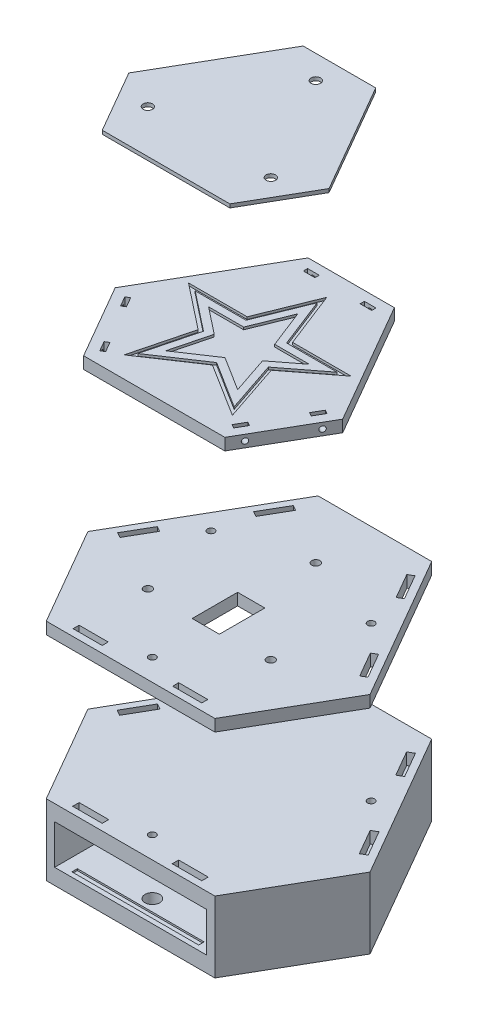
from build123d import *

# Parameters (mm, degrees)
SKETCH1_R                      = 1.49
BOTTOMPLATE_DEPTH              = 30
SKETCH2_R                      = 1.49
SKETCH2_W                      = 12.28
SKETCH2_H                      = 2.54
MIDDLEPLATE_DEPTH              = 5
TOPPLATE_DEPTH                 = 5
SKETCH5_R                      = 1.16
MAINHOLES_DEPTH                = 12
OTHERHOLES_COUNT               = 3
SKETCH8_R                      = 2
PCB_DEPTH                      = 1.5
NAME_START                     = -1
NAME_DEPTH                     = 1
STAR_DEPTH                     = 1
SKETCH18_W                     = 4.9
SKETCH18_H                     = 1.81
TOPFACENUTHOLES_DEPTH          = 5
SKETCH19_W                     = 64.2
SKETCH19_H                     = 16.7
BATTERY_DEPTH                  = 60.2
SKETCH19_3_R                   = 6.6
BATTERYCABLEHOLE_DEPTH         = 192.624263412
SKETCH1_4_W                    = 12.48
SKETCH1_4_H                    = 2.74
BOTTOMPLATESERVOCUT_DEPTH      = 5
SKETCH20_W                     = 53.6
SKETCH20_H                     = 2.3
WIREHOLE_DEPTH                 = 0.7
SKETCH21_R                     = 3.1
RUBBERFEETHOLES_DEPTH          = 26.5
WIREKNOTCH_DEPTH               = 62.5
SKETCH22_R                     = 1.7
SKETCH22_W                     = 11.5
SKETCH22_H                     = 19.2
SERVOHOLEANDCONNECTHOLES_DEPTH = 5
SKETCH23_W                     = 6
SKETCH23_H                     = 12
MIDDLEWIRECUTOUTS_DEPTH        = 2


# Read off the part's stored shape, not the designer's step: Name
with BuildPart() as part:
    # Sketch1 → BottomPlate (new body)
    with BuildSketch(Plane(origin=(0, -120, 0), x_dir=(1, 0, 0), z_dir=(0, 1, 0))):
        Polygon((59.623523599, -6.710844479), (35.623523599, -48.280063861), (-35.623523599, -48.280063861), (-59.623523599, -6.710844479), (-24, 54.990908339), (24, 54.990908339), align=None)
        with Locations(Location((-33.844328085, 19.54003193, 0), (0, 0, 270))):
            Circle(SKETCH1_R, mode=Mode.SUBTRACT)
        with Locations(Location((33.844328085, 19.54003193, 0), (0, 0, 270))):
            Circle(SKETCH1_R, mode=Mode.SUBTRACT)
        with Locations(Location((0, -39.080063861, 0), (0, 0, 270))):
            Circle(SKETCH1_R, mode=Mode.SUBTRACT)
    extrude(amount=-BOTTOMPLATE_DEPTH)

    # Name outline → Name (cut)
    # profile 1 of 7: a face of its own
    with BuildSketch(Plane.XZ.offset(150).offset(NAME_START)):
        with BuildLine():
            add(Edge.make_bspline(
                [(-28.694033388, -0.831367016), (-28.741037328, -0.95880174), (-28.833865851, -1.210473772), (-29.007446267, -1.56974132), (-29.200016788, -1.910725684), (-29.423674711, -2.226509117), (-29.66609623, -2.525565875), (-29.933985334, -2.804222954), (-30.230663625, -3.05718783), (-30.545415289, -3.29233975), (-30.87842937, -3.503953279), (-31.229286597, -3.683266504), (-31.590275425, -3.839060863), (-31.965330849, -3.964306708), (-32.351877753, -4.065574636), (-32.752379848, -4.132160478), (-33.164516992, -4.177388765), (-33.443907584, -4.18244244), (-33.585647312, -4.185006257)],
                knots=[0, 0, 0, 0, 0.0641545, 0.126699324, 0.188330083, 0.249006527, 0.309325989, 0.370140502, 0.431375342, 0.49336455, 0.555704542, 0.617575251, 0.679382668, 0.741335786, 0.804268289, 0.868008556, 0.933038435, 1, 1, 1, 1], degree=3))
            Line((-28.694033388, -0.831367016), (-25.646565034, 7.966892477))
            Line((-25.646565034, 7.966892477), (-30.203527059, 7.966892477))
            Line((-30.203527059, 7.966892477), (-30.730425793, 6.447905135))
            Line((-30.730425793, 6.447905135), (-28.148147312, 6.447905135))
            Line((-28.148147312, 6.447905135), (-30.455109337, -0.211904991))
            add(Edge.make_bspline(
                [(-31.361754907, -1.946873346), (-31.314093127, -1.897103214), (-31.21682163, -1.795528848), (-31.086730433, -1.623508031), (-30.967863373, -1.43232382), (-30.819101104, -1.143097245), (-30.644197668, -0.73570749), (-30.520479843, -0.392990909), (-30.455109337, -0.211904991)],
                knots=[0, 0, 0, 0, 0.104647409, 0.213571755, 0.326987889, 0.446364238, 0.707467786, 1, 1, 1, 1], degree=3))
            add(Edge.make_bspline(
                [(-33.205900477, -2.514120181), (-33.095052618, -2.512608628), (-32.884031147, -2.509731079), (-32.58369432, -2.479921343), (-32.314294134, -2.438316685), (-32.076282738, -2.37031346), (-31.865048901, -2.286820576), (-31.676237051, -2.188477059), (-31.505697336, -2.079239819), (-31.408892135, -1.990219763), (-31.361754907, -1.946873346)],
                knots=[0, 0, 0, 0, 0.16798201, 0.319787964, 0.457220611, 0.58061715, 0.694204393, 0.800956134, 0.903079836, 1, 1, 1, 1], degree=3))
            add(Edge.make_bspline(
                [(-34.79609035, -2.210322713), (-34.67768465, -2.247633408), (-34.432978495, -2.324742506), (-34.049771973, -2.425666778), (-33.637600433, -2.502097205), (-33.35183426, -2.510055881), (-33.205900477, -2.514120181)],
                knots=[0, 0, 0, 0, 0.229013655, 0.473296902, 0.731025631, 1, 1, 1, 1], degree=3))
            Line((-34.79609035, -2.210322713), (-35.095140983, -2.210322713))
            Line((-35.095140983, -2.210322713), (-35.690868831, -3.931050561))
            add(Edge.make_bspline(
                [(-33.585647312, -4.185006257), (-33.655277172, -4.183776696), (-33.804110265, -4.181148524), (-34.04082779, -4.169268616), (-34.304194875, -4.146699941), (-34.682417495, -4.11038689), (-35.149867369, -4.047918178), (-35.515651325, -3.968901202), (-35.690868831, -3.931050561)],
                knots=[0, 0, 0, 0, 0.098352377, 0.210227171, 0.334660271, 0.471635063, 0.746903097, 1, 1, 1, 1], degree=3))
        make_face()
    # profile 2 of 7: a face of its own
    with BuildSketch(Plane.XZ.offset(150).offset(NAME_START)):
        with BuildLine():
            add(Edge.make_bspline(
                [(18.456828492, -3.284602125), (18.427882268, -3.312285196), (18.348742238, -3.378732564), (18.116749488, -3.515116911), (17.777222788, -3.700402739), (17.481384899, -3.825073672), (17.331283068, -3.888329042)],
                knots=[0.126856561, 0.126856561, 0.126856561, 0.126856561, 0.206335754, 0.345716966, 0.668030754, 1, 1, 1, 1], degree=3))
            Line((18.456828492, -3.284602125), (18.197580536, -4.033107523))
            Line((18.197580536, -4.033107523), (20.17226408, -4.033107523))
            Line((20.17226408, -4.033107523), (22.315460283, 2.156765895))
            add(Edge.make_bspline(
                [(22.018783068, 4.667841844), (22.090570732, 4.593511714), (22.231153492, 4.447950011), (22.389261563, 4.190790099), (22.498145628, 3.914293712), (22.554161094, 3.615029402), (22.565330909, 3.291938916), (22.525745996, 2.940102556), (22.444390665, 2.556217252), (22.359920192, 2.294511325), (22.315460283, 2.156765895)],
                knots=[0, 0, 0, 0, 0.114980238, 0.225167364, 0.334139349, 0.444725033, 0.563052852, 0.693443545, 0.838648091, 1, 1, 1, 1], degree=3))
            add(Edge.make_bspline(
                [(19.220523574, 5.384613996), (19.379621248, 5.383417726), (19.687120015, 5.381105616), (20.130568702, 5.345859833), (20.540192717, 5.296690126), (20.912991682, 5.220597962), (21.250390748, 5.125390332), (21.547904205, 5.003584905), (21.806381334, 4.854042073), (21.94933207, 4.728725489), (22.018783068, 4.667841844)],
                knots=[0, 0, 0, 0, 0.161576161, 0.312289108, 0.451652118, 0.580427712, 0.698443407, 0.807252361, 0.90635574, 1, 1, 1, 1], degree=3))
            add(Edge.make_bspline(
                [(15.98555522, 4.931291211), (16.097813433, 4.957762265), (16.331348418, 5.012830995), (16.697511169, 5.091410096), (17.094069375, 5.166738264), (17.514721728, 5.239899732), (17.94661523, 5.303368286), (18.37780742, 5.352658733), (18.801696277, 5.378105917), (19.082046255, 5.382462223), (19.220523574, 5.384613996)],
                knots=[0, 0, 0, 0, 0.105685584, 0.219861695, 0.343130222, 0.475541556, 0.611077371, 0.743091204, 0.873101322, 1, 1, 1, 1], degree=3))
            Line((15.98555522, 4.931291211), (15.354226106, 3.106132984))
            Line((15.354226106, 3.106132984), (15.653276739, 3.113253237))
            add(Edge.make_bspline(
                [(18.677010916, 3.865626654), (18.583575544, 3.862941815), (18.387487056, 3.857307266), (18.079933577, 3.821939811), (17.746308715, 3.765182354), (17.386032792, 3.681557298), (16.995377442, 3.581214609), (16.576347283, 3.447730286), (16.123434459, 3.294675959), (15.81423744, 3.175364157), (15.653276739, 3.113253237)],
                knots=[0, 0, 0, 0, 0.089513307, 0.187857432, 0.296259367, 0.413568624, 0.542066876, 0.682543713, 0.834739718, 1, 1, 1, 1], degree=3))
            add(Edge.make_bspline(
                [(20.203118511, 3.564202604), (20.161148681, 3.592428075), (20.073835122, 3.651148024), (19.921010599, 3.716472007), (19.748068451, 3.767931212), (19.484226591, 3.817351442), (19.125118788, 3.85601376), (18.829812164, 3.862348733), (18.677010916, 3.865626654)],
                knots=[0, 0, 0, 0, 0.095986647, 0.199689533, 0.31437466, 0.438569509, 0.70949761, 1, 1, 1, 1], degree=3))
            add(Edge.make_bspline(
                [(20.383498258, 2.282557034), (20.408883665, 2.358837075), (20.456971442, 2.503334959), (20.499612467, 2.713579124), (20.516860477, 2.902781156), (20.50241486, 3.071091519), (20.464895013, 3.221679454), (20.402136906, 3.354695558), (20.315687633, 3.472105252), (20.240973248, 3.533232112), (20.203118511, 3.564202604)],
                knots=[0, 0, 0, 0, 0.172878686, 0.327485458, 0.46068689, 0.580311561, 0.689336314, 0.792920325, 0.89508116, 1, 1, 1, 1], degree=3))
            Line((20.383498258, 2.282557034), (20.350270409, 2.185246908))
            add(Edge.make_bspline(
                [(15.79805522, 1.492208933), (15.961703924, 1.552809414), (16.295881803, 1.676558271), (16.824632357, 1.811415213), (17.381139755, 1.925428278), (18.163192015, 2.026630152), (19.155919685, 2.114883492), (19.953774487, 2.161887934), (20.350270409, 2.185246908)],
                knots=[0, 0, 0, 0, 0.113141193, 0.231039309, 0.353539834, 0.48150945, 0.742334835, 1, 1, 1, 1], degree=3))
            add(Edge.make_bspline(
                [(13.063878004, -1.310797396), (13.128832077, -1.138208742), (13.255431294, -0.801823542), (13.505716923, -0.337221105), (13.789700147, 0.080429537), (14.119906176, 0.445475477), (14.48919647, 0.763167178), (14.889870321, 1.048536231), (15.328281742, 1.293854305), (15.640052391, 1.425494668), (15.79805522, 1.492208933)],
                knots=[0, 0, 0, 0, 0.136383217, 0.265818722, 0.389612351, 0.509459632, 0.629018921, 0.74959669, 0.87309764, 1, 1, 1, 1], degree=3))
            add(Edge.make_bspline(
                [(15.04805522, -4.336904991), (14.945885721, -4.333915725), (14.747937283, -4.328124168), (14.461266714, -4.290834737), (14.195441673, -4.225200488), (13.951979021, -4.128260032), (13.726934586, -4.011102184), (13.524570798, -3.863259412), (13.343398929, -3.689818738), (13.187092857, -3.489427187), (13.056324475, -3.269925374), (12.95797465, -3.032495865), (12.894147378, -2.779832542), (12.860880565, -2.513583659), (12.861825256, -2.232277938), (12.896539815, -1.936560662), (12.963001682, -1.625936824), (13.029602109, -1.417875904), (13.063878004, -1.310797396)],
                knots=[0, 0, 0, 0, 0.069766954, 0.135170083, 0.197015754, 0.256206497, 0.31372674, 0.369810838, 0.426742004, 0.484454742, 0.542826213, 0.600715683, 0.659286818, 0.720265145, 0.783473816, 0.850889818, 0.923260477, 1, 1, 1, 1], degree=3))
            add(Edge.make_bspline(
                [(17.331283068, -3.888329042), (17.26031532, -3.916644895), (17.111724494, -3.975932051), (16.87482458, -4.055671636), (16.615103289, -4.131519102), (16.335356604, -4.20273697), (16.0362115, -4.262740249), (15.720665543, -4.30446705), (15.389497136, -4.331305974), (15.163615184, -4.335010021), (15.04805522, -4.336904991)],
                knots=[0, 0, 0, 0, 0.097870701, 0.20491968, 0.320054658, 0.444435984, 0.574627718, 0.710653522, 0.851971934, 1, 1, 1, 1], degree=3))
        make_face()
        with BuildLine():
            add(Edge.make_bspline(
                [(16.149321042, -2.666018915), (16.276124342, -2.662409111), (16.529424234, -2.655198233), (16.906979122, -2.595302997), (17.281594008, -2.500882909), (17.770435323, -2.320284124), (18.356694327, -2.049503086), (18.800695468, -1.791274948), (19.018783068, -1.664436637)],
                knots=[0, 0, 0, 0, 0.123537472, 0.246776136, 0.371713666, 0.499528622, 0.754174953, 1, 1, 1, 1], degree=3))
            add(Edge.make_bspline(
                [(15.069415979, -1.225354358), (15.048518378, -1.28754061), (15.008963114, -1.405247596), (14.969520012, -1.578742397), (14.940492759, -1.737786448), (14.934820536, -1.884341763), (14.939377525, -2.017839369), (14.965859002, -2.13727146), (15.008312749, -2.243873413), (15.069462322, -2.336081046), (15.1469198, -2.416608118), (15.243686473, -2.481700281), (15.354190823, -2.539405951), (15.480756149, -2.586924393), (15.62513459, -2.621711656), (15.785497482, -2.646783682), (15.962232225, -2.664321831), (16.085191966, -2.6654372), (16.149321042, -2.666018915)],
                knots=[0, 0, 0, 0, 0.084940203, 0.160775975, 0.230376395, 0.294006244, 0.350469925, 0.402950055, 0.451682209, 0.498309656, 0.545430292, 0.595481495, 0.64866769, 0.706736945, 0.770135172, 0.840747332, 0.916942518, 1, 1, 1, 1], degree=3))
            add(Edge.make_bspline(
                [(16.832865346, 0.317367161), (16.738790564, 0.290144866), (16.552019812, 0.236099263), (16.283780383, 0.118294409), (16.025212294, -0.02023035), (15.779709375, -0.187000477), (15.549778729, -0.38202448), (15.356509889, -0.626049828), (15.190512231, -0.907721529), (15.110671592, -1.117141785), (15.069415979, -1.225354358)],
                knots=[0, 0, 0, 0, 0.119867087, 0.237977337, 0.358114533, 0.47882516, 0.60110174, 0.725839198, 0.858334402, 1, 1, 1, 1], degree=3))
            add(Edge.make_bspline(
                [(19.828118511, 0.675753237), (19.731612862, 0.667674437), (19.522034972, 0.650129993), (19.181599721, 0.625500669), (18.790953314, 0.59083577), (18.36422795, 0.555578207), (17.933248603, 0.513933429), (17.528781312, 0.459075151), (17.165508501, 0.397541521), (16.939425295, 0.343050466), (16.832865346, 0.317367161)],
                knots=[0, 0, 0, 0, 0.096196136, 0.208905731, 0.339038116, 0.4857474, 0.63424118, 0.769054094, 0.891148112, 1, 1, 1, 1], degree=3))
            Line((19.828118511, 0.675753237), (19.018783068, -1.664436637))
        make_face(mode=Mode.SUBTRACT)
    # profile 3 of 7: a face of its own
    with BuildSketch(Plane.XZ.offset(150).offset(NAME_START)):
        with BuildLine():
            add(Edge.make_bspline(
                [(-9.172672629, 0.383822857), (-9.139946507, 0.326953041), (-9.074823179, 0.21378498), (-9.010269589, 0.02765399), (-8.963839796, -0.16540742), (-8.943081602, -0.368834274), (-8.946029945, -0.582130503), (-8.972758785, -0.804686361), (-9.022816297, -1.036768073), (-9.073145609, -1.19094946), (-9.099096679, -1.270449295)],
                knots=[0, 0, 0, 0, 0.114645939, 0.228139628, 0.343386511, 0.461786925, 0.585077764, 0.716175345, 0.853652806, 1, 1, 1, 1], degree=3))
            add(Edge.make_bspline(
                [(-10.615710603, 1.240626654), (-10.529936697, 1.218032468), (-10.363088269, 1.174081986), (-10.127312302, 1.091836885), (-9.913683668, 0.99788153), (-9.721052992, 0.897678728), (-9.551229735, 0.784136775), (-9.399872372, 0.665355248), (-9.274893043, 0.529899104), (-9.206441173, 0.432079189), (-9.172672629, 0.383822857)],
                knots=[0, 0, 0, 0, 0.154832234, 0.301181514, 0.435405277, 0.56208159, 0.679697594, 0.79166203, 0.897223114, 1, 1, 1, 1], degree=3))
            add(Edge.make_bspline(
                [(-12.248621996, 1.606132984), (-12.109550051, 1.57216424), (-11.823498619, 1.502295311), (-11.395285624, 1.41245171), (-10.988579299, 1.331303664), (-10.732633963, 1.269060955), (-10.615710603, 1.240626654)],
                knots=[0, 0, 0, 0, 0.256626059, 0.527843715, 0.784305116, 1, 1, 1, 1], degree=3))
            add(Edge.make_bspline(
                [(-13.050837185, 2.023854503), (-13.006606229, 1.979061354), (-12.912500152, 1.883759152), (-12.725640277, 1.77609982), (-12.503530908, 1.676887295), (-12.33727071, 1.630738945), (-12.248621996, 1.606132984)],
                knots=[0, 0, 0, 0, 0.205125062, 0.436425452, 0.699506198, 1, 1, 1, 1], degree=3))
            add(Edge.make_bspline(
                [(-13.029476426, 2.731132984), (-13.054615469, 2.65168831), (-13.100054283, 2.508092085), (-13.132201446, 2.30900403), (-13.124387548, 2.142127592), (-13.073764542, 2.060722972), (-13.050837185, 2.023854503)],
                knots=[0, 0, 0, 0, 0.339595341, 0.613818482, 0.825096888, 1, 1, 1, 1], degree=3))
            add(Edge.make_bspline(
                [(-10.997830856, 3.865626654), (-11.111930212, 3.862516639), (-11.335720785, 3.85641676), (-11.663280006, 3.80601924), (-11.972943579, 3.720169934), (-12.262344438, 3.603342636), (-12.524454873, 3.451788227), (-12.743298439, 3.252594013), (-12.916315647, 3.010128027), (-12.991179447, 2.825553217), (-13.029476426, 2.731132984)],
                knots=[0, 0, 0, 0, 0.137401543, 0.269494688, 0.398054302, 0.523712681, 0.644663954, 0.760701704, 0.877585674, 1, 1, 1, 1], degree=3))
            add(Edge.make_bspline(
                [(-8.429792882, 2.802335515), (-8.505561648, 2.878682852), (-8.65978207, 3.034080899), (-8.929135041, 3.234089535), (-9.22757476, 3.415834115), (-9.554644761, 3.572336006), (-9.900556915, 3.702295334), (-10.258539322, 3.799095302), (-10.625867595, 3.85397824), (-10.873448647, 3.861731497), (-10.997830856, 3.865626654)],
                knots=[0, 0, 0, 0, 0.112964168, 0.229928273, 0.351624547, 0.479987574, 0.610552858, 0.739695233, 0.869225525, 1, 1, 1, 1], degree=3))
            Line((-8.429792882, 2.802335515), (-7.993084021, 2.802335515))
            Line((-7.993084021, 2.802335515), (-7.366501742, 4.608506401))
            add(Edge.make_bspline(
                [(-10.359381489, 5.384613996), (-10.22002483, 5.382820667), (-9.943082648, 5.379256801), (-9.531955607, 5.33571682), (-9.126301274, 5.273626171), (-8.731248332, 5.180338544), (-8.352368286, 5.067909898), (-7.996239112, 4.937799006), (-7.667429871, 4.787564973), (-7.465224314, 4.66724841), (-7.366501742, 4.608506401)],
                knots=[0, 0, 0, 0, 0.13353165, 0.265366194, 0.395909576, 0.526708253, 0.654121134, 0.774574949, 0.889941004, 1, 1, 1, 1], degree=3))
            add(Edge.make_bspline(
                [(-13.413970097, 4.542050705), (-13.310506341, 4.605481068), (-13.099603868, 4.734778718), (-12.760742217, 4.898680801), (-12.398680549, 5.041945943), (-12.016543638, 5.164059156), (-11.618249312, 5.26464514), (-11.206866345, 5.331840737), (-10.786805033, 5.376796054), (-10.502696567, 5.381992641), (-10.359381489, 5.384613996)],
                knots=[0, 0, 0, 0, 0.113342475, 0.23103944, 0.35115383, 0.476928774, 0.6056604, 0.734604104, 0.866124252, 1, 1, 1, 1], degree=3))
            add(Edge.make_bspline(
                [(-15.072989084, 2.534139313), (-15.036925256, 2.629913462), (-14.964171527, 2.823124408), (-14.819102816, 3.099400031), (-14.652844702, 3.370498125), (-14.456909526, 3.630575987), (-14.237896531, 3.883793064), (-13.985412109, 4.116888208), (-13.71395314, 4.34293925), (-13.514973292, 4.475010605), (-13.413970097, 4.542050705)],
                knots=[0, 0, 0, 0, 0.115620364, 0.233247908, 0.352161112, 0.474899396, 0.601049291, 0.730149523, 0.863022508, 1, 1, 1, 1], degree=3))
            add(Edge.make_bspline(
                [(-13.710647312, 0.013569692), (-13.798065797, 0.040878605), (-13.966131089, 0.093381007), (-14.203207951, 0.188236233), (-14.413936711, 0.295937845), (-14.603986365, 0.408005111), (-14.765313178, 0.534615499), (-14.903800396, 0.668686196), (-15.016472702, 0.81377256), (-15.102523532, 0.970681113), (-15.166876586, 1.136143339), (-15.211523164, 1.309866218), (-15.238935135, 1.492860965), (-15.241105488, 1.684606861), (-15.230916456, 1.885798779), (-15.19508826, 2.093993374), (-15.146442947, 2.312819955), (-15.098071105, 2.458566204), (-15.072989084, 2.534139313)],
                knots=[0, 0, 0, 0, 0.08227933, 0.158185075, 0.229082001, 0.294796198, 0.35608558, 0.412890196, 0.467633439, 0.520455099, 0.573128256, 0.626752269, 0.681342978, 0.738942721, 0.798763281, 0.862108439, 0.928499746, 1, 1, 1, 1], degree=3))
            add(Edge.make_bspline(
                [(-12.089603008, -0.35905689), (-12.211234677, -0.329625411), (-12.472534623, -0.266398095), (-12.88227626, -0.188726132), (-13.302731955, -0.100242446), (-13.578079661, -0.023417902), (-13.710647312, 0.013569692)],
                knots=[0, 0, 0, 0, 0.225609278, 0.484673877, 0.751893435, 1, 1, 1, 1], degree=3))
            add(Edge.make_bspline(
                [(-11.154476426, -0.783898662), (-11.194569382, -0.741923782), (-11.28736029, -0.64477736), (-11.497374682, -0.544691358), (-11.767189287, -0.441231597), (-11.974823631, -0.388311109), (-12.089603008, -0.35905689)],
                knots=[0, 0, 0, 0, 0.165978197, 0.384138991, 0.65955467, 1, 1, 1, 1], degree=3))
            add(Edge.make_bspline(
                [(-11.14023592, -1.460322713), (-11.119086653, -1.390430551), (-11.079947458, -1.261086921), (-11.056479235, -1.074361803), (-11.079539968, -0.910853263), (-11.130368094, -0.824742114), (-11.154476426, -0.783898662)],
                knots=[0, 0, 0, 0, 0.311422813, 0.576324389, 0.799046059, 1, 1, 1, 1], degree=3))
            add(Edge.make_bspline(
                [(-13.466185287, -2.666018915), (-13.318046221, -2.662594489), (-13.034916782, -2.656049584), (-12.630871436, -2.600865687), (-12.267867571, -2.51364192), (-11.946798564, -2.385293253), (-11.670009451, -2.217339687), (-11.440870243, -2.005376984), (-11.257562316, -1.752445693), (-11.179816925, -1.558872754), (-11.14023592, -1.460322713)],
                knots=[0, 0, 0, 0, 0.158077705, 0.302124573, 0.434448998, 0.555681276, 0.669825433, 0.777998732, 0.886976793, 1, 1, 1, 1], degree=3))
            add(Edge.make_bspline(
                [(-16.07694478, -1.450829042), (-15.984633633, -1.54766952), (-15.803503381, -1.737687092), (-15.503885394, -1.98652413), (-15.187114961, -2.196581886), (-14.854574567, -2.367003006), (-14.512442401, -2.500450585), (-14.165562866, -2.595010882), (-13.816369773, -2.655071585), (-13.582717687, -2.662375925), (-13.466185287, -2.666018915)],
                knots=[0, 0, 0, 0, 0.135245825, 0.265375426, 0.393000486, 0.518986653, 0.642633078, 0.763778378, 0.882186061, 1, 1, 1, 1], degree=3))
            Line((-16.07694478, -1.450829042), (-16.45194478, -1.450829042))
            Line((-16.45194478, -1.450829042), (-17.11887516, -3.378044232))
            add(Edge.make_bspline(
                [(-14.107008072, -4.185006257), (-14.267733613, -4.182694388), (-14.579576228, -4.178208859), (-15.03081037, -4.131718359), (-15.451284546, -4.060415515), (-15.839263286, -3.954469594), (-16.196398123, -3.827009139), (-16.529382955, -3.692367059), (-16.835359838, -3.543704751), (-17.026161837, -3.43221745), (-17.11887516, -3.378044232)],
                knots=[0, 0, 0, 0, 0.152571985, 0.296022937, 0.430279709, 0.557117791, 0.677342555, 0.790206422, 0.898058406, 1, 1, 1, 1], degree=3))
            add(Edge.make_bspline(
                [(-9.099096679, -1.270449295), (-9.137158584, -1.372721709), (-9.213277381, -1.577253068), (-9.36957111, -1.867735576), (-9.54882075, -2.148377376), (-9.759050575, -2.41511964), (-9.999146024, -2.668096034), (-10.266819312, -2.910041674), (-10.565558241, -3.137704241), (-10.889109405, -3.352939474), (-11.234842374, -3.549246556), (-11.600260654, -3.717053244), (-11.978662578, -3.863052492), (-12.373520882, -3.982431623), (-12.785871136, -4.070834815), (-13.212734314, -4.138546125), (-13.655400296, -4.175727394), (-13.955046402, -4.181884009), (-14.107008072, -4.185006257)],
                knots=[0, 0, 0, 0, 0.053043622, 0.106080258, 0.160113494, 0.214947186, 0.271047362, 0.329650247, 0.390325613, 0.453641326, 0.518629608, 0.583563137, 0.649123574, 0.715864689, 0.784052365, 0.854180492, 0.926049511, 1, 1, 1, 1], degree=3))
        make_face()
    # profile 4 of 7: a face of its own
    with BuildSketch(Plane.XZ.offset(150).offset(NAME_START)):
        with BuildLine():
            add(Edge.make_bspline(
                [(-20.156849844, 5.384613996), (-19.992881308, 5.380620057), (-19.677151026, 5.37292951), (-19.224179979, 5.311567147), (-18.812197654, 5.208851577), (-18.442762605, 5.060498313), (-18.112916349, 4.87311815), (-17.827137561, 4.639980496), (-17.583710877, 4.364938012), (-17.384747156, 4.050356823), (-17.230403061, 3.701275934), (-17.121650373, 3.323540194), (-17.05733858, 2.919457362), (-17.043051703, 2.489495286), (-17.072112242, 2.033208183), (-17.150818479, 1.550975026), (-17.272023852, 1.040811875), (-17.383760525, 0.697173426), (-17.44165997, 0.519107667)],
                knots=[0, 0, 0, 0, 0.071642452, 0.137951416, 0.199339362, 0.256741703, 0.311424012, 0.364508764, 0.417171802, 0.471271607, 0.526531361, 0.583431631, 0.642608187, 0.704894218, 0.771066912, 0.8421254, 0.918192913, 1, 1, 1, 1], degree=3))
            add(Edge.make_bspline(
                [(-26.099887818, 0.519107667), (-26.033356421, 0.701980078), (-25.902157718, 1.062601137), (-25.668501995, 1.580179815), (-25.40941734, 2.068655306), (-25.124148093, 2.527949163), (-24.812871537, 2.958999332), (-24.474709335, 3.360136231), (-24.114117389, 3.735844819), (-23.724745435, 4.074424171), (-23.321821798, 4.383939663), (-22.902005936, 4.650675379), (-22.471623281, 4.876625542), (-22.030915928, 5.06389347), (-21.577572551, 5.20635288), (-21.113753183, 5.308050147), (-20.638853255, 5.372129623), (-20.318442772, 5.380428577), (-20.156849844, 5.384613996)],
                knots=[0, 0, 0, 0, 0.071117285, 0.140241989, 0.207389099, 0.273115482, 0.337733669, 0.401572466, 0.464771306, 0.527890026, 0.590013005, 0.650345769, 0.709464374, 0.767528753, 0.825152836, 0.88290306, 0.940944387, 1, 1, 1, 1], degree=3))
            add(Edge.make_bspline(
                [(-23.522356173, -4.336904991), (-23.679189446, -4.332677611), (-23.98138619, -4.324532015), (-24.415479045, -4.26614156), (-24.811002247, -4.165694784), (-25.165415577, -4.019034334), (-25.483841566, -3.836772221), (-25.759925169, -3.608168593), (-25.995180063, -3.338187858), (-26.190342189, -3.030131309), (-26.342484958, -2.687127775), (-26.446418292, -2.312013425), (-26.505381818, -1.909426933), (-26.515118673, -1.477916015), (-26.48016932, -1.018042962), (-26.401044362, -0.528989449), (-26.273523939, -0.011394188), (-26.159212906, 0.33785466), (-26.099887818, 0.519107667)],
                knots=[0, 0, 0, 0, 0.069466031, 0.133851752, 0.193611877, 0.249715518, 0.30327427, 0.35555289, 0.407711542, 0.461284053, 0.51651277, 0.57332027, 0.63319539, 0.696305524, 0.764125249, 0.837243955, 0.915532942, 1, 1, 1, 1], degree=3))
            add(Edge.make_bspline(
                [(-17.44165997, 0.519107667), (-17.507369055, 0.340164896), (-17.636924463, -0.01264787), (-17.869671752, -0.52041132), (-18.127349291, -1.002070067), (-18.413295994, -1.457507507), (-18.726246149, -1.886063879), (-19.070750124, -2.285088067), (-19.437690246, -2.662114521), (-19.833626734, -3.006135204), (-20.246364112, -3.320162982), (-20.677050187, -3.591334843), (-21.120426928, -3.820115096), (-21.575945018, -4.008893488), (-22.044327999, -4.156768558), (-22.525749027, -4.261038577), (-23.01987125, -4.324360717), (-23.353657464, -4.332693516), (-23.522356173, -4.336904991)],
                knots=[0, 0, 0, 0, 0.068767794, 0.135586118, 0.201366873, 0.265764566, 0.329489851, 0.392660188, 0.455849231, 0.519177426, 0.581757297, 0.642826361, 0.702583394, 0.761592398, 0.820553729, 0.879575162, 0.939136148, 1, 1, 1, 1], degree=3))
        make_face()
        with BuildLine():
            add(Edge.make_bspline(
                [(-22.997830856, -2.817917649), (-22.904310724, -2.816110171), (-22.718740222, -2.812523622), (-22.444863331, -2.769324553), (-22.176240192, -2.705353423), (-21.913456284, -2.615832269), (-21.657465208, -2.497534854), (-21.407700233, -2.355159419), (-21.164910754, -2.184710543), (-20.927346121, -1.990725351), (-20.699479335, -1.768563466), (-20.479825207, -1.521383593), (-20.275022072, -1.245209731), (-20.078558777, -0.944823061), (-19.897320301, -0.615965663), (-19.723610744, -0.262369631), (-19.562330493, 0.118390753), (-19.465794316, 0.383371092), (-19.416343515, 0.519107667)],
                knots=[0, 0, 0, 0, 0.053506029, 0.106171157, 0.158364574, 0.211516535, 0.264832353, 0.319619555, 0.375921726, 0.434508727, 0.495061313, 0.557966245, 0.623656234, 0.691762239, 0.763354576, 0.838522801, 0.917283063, 1, 1, 1, 1], degree=3))
            add(Edge.make_bspline(
                [(-24.125204274, 0.519107667), (-24.170761152, 0.381844894), (-24.258156251, 0.118523654), (-24.364053911, -0.266838764), (-24.437865972, -0.625298827), (-24.484513496, -0.955897535), (-24.50216526, -1.258395852), (-24.492754735, -1.533295992), (-24.450044374, -1.780744365), (-24.379899733, -2.001195164), (-24.280494351, -2.193682455), (-24.161691152, -2.361025577), (-24.02225966, -2.505065344), (-23.857660524, -2.619096118), (-23.673210121, -2.710531176), (-23.466465346, -2.773882617), (-23.238991406, -2.812369856), (-23.080271644, -2.816021135), (-22.997830856, -2.817917649)],
                knots=[0, 0, 0, 0, 0.101151841, 0.194046993, 0.279349944, 0.356984874, 0.427370661, 0.49106935, 0.548931189, 0.602480423, 0.652226072, 0.699829521, 0.745613052, 0.791673324, 0.839189849, 0.889070744, 0.942382126, 1, 1, 1, 1], degree=3))
            add(Edge.make_bspline(
                [(-20.683748578, 3.865626654), (-20.769333505, 3.863528227), (-20.940561915, 3.859329936), (-21.194102726, 3.819695411), (-21.44338085, 3.757311511), (-21.688677302, 3.672088425), (-21.92948049, 3.559749702), (-22.164771904, 3.420171646), (-22.397355461, 3.259550243), (-22.624474094, 3.07236244), (-22.845394783, 2.859746741), (-23.05492402, 2.6145331), (-23.256448382, 2.340476706), (-23.451664886, 2.037014984), (-23.633107266, 1.699945462), (-23.809045648, 1.334446643), (-23.974922711, 0.938148706), (-24.074246554, 0.661196793), (-24.125204274, 0.519107667)],
                knots=[0, 0, 0, 0, 0.049973206, 0.099980601, 0.149530907, 0.199963724, 0.251455091, 0.30448965, 0.359623771, 0.416439214, 0.47625874, 0.538526453, 0.604625498, 0.674888987, 0.749146864, 0.828120195, 0.91181772, 1, 1, 1, 1], degree=3))
            add(Edge.make_bspline(
                [(-19.416343515, 0.519107667), (-19.370743516, 0.657156376), (-19.283243162, 0.922053551), (-19.178064905, 1.309126801), (-19.102844494, 1.66804531), (-19.059729295, 1.998949566), (-19.042969736, 2.30237576), (-19.059051402, 2.577850877), (-19.102386171, 2.826792781), (-19.179143514, 3.047318117), (-19.281775237, 3.241748054), (-19.408766015, 3.411424614), (-19.562991377, 3.552930054), (-19.741793605, 3.667613212), (-19.943115964, 3.758595238), (-20.168693504, 3.821756276), (-20.418182667, 3.860220577), (-20.592617963, 3.863771525), (-20.683748578, 3.865626654)],
                knots=[0, 0, 0, 0, 0.098920485, 0.189815299, 0.272804213, 0.348262093, 0.416710988, 0.479275185, 0.535662563, 0.588102954, 0.637474483, 0.684743613, 0.731606305, 0.77909261, 0.828727613, 0.881380364, 0.938029283, 1, 1, 1, 1], degree=3))
        make_face(mode=Mode.SUBTRACT)
    # profile 5 of 7: a face of its own
    with BuildSketch(Plane.XZ.offset(150).offset(NAME_START)):
        with BuildLine():
            add(Edge.make_bspline(
                [(-0.495457439, 1.202651971), (-0.432513555, 1.395053813), (-0.311693482, 1.764366968), (-0.192081959, 2.221725123), (-0.129181834, 2.558271337), (-0.102901971, 2.774602125), (-0.102374819, 2.961020226), (-0.122977624, 3.072274174), (-0.132324527, 3.122746908)],
                knots=[0, 0, 0, 0, 0.307830857, 0.59087784, 0.718072884, 0.828215525, 0.922066298, 1, 1, 1, 1], degree=3))
            Line((-0.495457439, 1.202651971), (-2.308748578, -4.033107523))
            Line((-2.308748578, -4.033107523), (-0.334065034, -4.033107523))
            Line((-0.334065034, -4.033107523), (1.711821042, 1.874329186))
            add(Edge.make_bspline(
                [(-0.246248578, 5.384613996), (-0.120299997, 5.382356448), (0.121406831, 5.378024007), (0.466401663, 5.332254329), (0.777418555, 5.26043229), (1.053649997, 5.157969367), (1.297381159, 5.028263367), (1.504104786, 4.863853744), (1.679025273, 4.67202453), (1.813390127, 4.448109968), (1.916151684, 4.201683176), (1.984241824, 3.932119892), (2.022010476, 3.641386775), (2.025382452, 3.328610726), (1.995984697, 2.994911255), (1.931689036, 2.640042273), (1.840232378, 2.262033639), (1.755657404, 2.006681619), (1.711821042, 1.874329186)],
                knots=[0, 0, 0, 0, 0.075190647, 0.144297717, 0.207453131, 0.265472361, 0.319818908, 0.371628472, 0.422489716, 0.474035682, 0.526780751, 0.581452993, 0.6395991, 0.70151178, 0.767912879, 0.839388385, 0.91675281, 1, 1, 1, 1], degree=3))
            add(Edge.make_bspline(
                [(-3.269982755, 4.155183616), (-3.18303226, 4.2464854), (-3.005141987, 4.433277885), (-2.683378926, 4.669183078), (-2.317898256, 4.879021856), (-1.912636351, 5.053633626), (-1.490369996, 5.198624596), (-1.068537428, 5.306951378), (-0.654078475, 5.371120808), (-0.380950977, 5.380157322), (-0.246248578, 5.384613996)],
                knots=[0, 0, 0, 0, 0.11275207, 0.230677196, 0.355761452, 0.489672754, 0.625261274, 0.755375759, 0.879354981, 1, 1, 1, 1], degree=3))
            Line((-3.269982755, 4.155183616), (-1.741501742, 8.574487414))
            Line((-1.741501742, 8.574487414), (-3.716185287, 8.574487414))
            Line((-3.716185287, 8.574487414), (-8.080900477, -4.033107523))
            Line((-8.080900477, -4.033107523), (-6.106216932, -4.033107523))
            Line((-6.106216932, -4.033107523), (-3.75415997, 2.759613996))
            add(Edge.make_bspline(
                [(-1.273938451, 3.71372792), (-1.359616633, 3.710363562), (-1.540319845, 3.70326782), (-1.820571932, 3.646287467), (-2.124593573, 3.560239269), (-2.559545928, 3.395568565), (-3.115587408, 3.141460005), (-3.539602654, 2.887912423), (-3.75415997, 2.759613996)],
                knots=[0, 0, 0, 0, 0.095651673, 0.201738228, 0.318404384, 0.448432507, 0.720899561, 1, 1, 1, 1], degree=3))
            add(Edge.make_bspline(
                [(-0.132324527, 3.122746908), (-0.145027849, 3.170376172), (-0.169681451, 3.26281128), (-0.245523175, 3.384364711), (-0.341928538, 3.490115414), (-0.469518913, 3.573653469), (-0.625912138, 3.637334111), (-0.812623331, 3.684619179), (-1.032833106, 3.708248596), (-1.190031498, 3.711821063), (-1.273938451, 3.71372792)],
                knots=[0, 0, 0, 0, 0.104982753, 0.20374222, 0.30321079, 0.409375529, 0.527024446, 0.663407617, 0.820338865, 1, 1, 1, 1], degree=3))
        make_face()
    # profile 6 of 7: a face of its own
    with BuildSketch(Plane.XZ.offset(150).offset(NAME_START)):
        with BuildLine():
            add(Edge.make_bspline(
                [(8.340776739, -3.107474611), (8.244471512, -3.195111705), (8.047265839, -3.374567512), (7.710552213, -3.60719819), (7.337521741, -3.816634259), (6.933874465, -4.000061618), (6.507118851, -4.148095837), (6.069936573, -4.258501047), (5.624451503, -4.32468883), (5.325172634, -4.33281672), (5.174637498, -4.336904991)],
                knots=[0, 0, 0, 0, 0.112308464, 0.229975747, 0.352303874, 0.481291641, 0.612185602, 0.741721887, 0.870087952, 1, 1, 1, 1], degree=3))
            Line((8.340776739, -3.107474611), (8.020365346, -4.033107523))
            Line((8.020365346, -4.033107523), (9.99504889, -4.033107523))
            Line((9.99504889, -4.033107523), (13.15169446, 5.080816528))
            Line((13.15169446, 5.080816528), (11.177010916, 5.080816528))
            Line((11.177010916, 5.080816528), (8.83919446, -1.666810054))
            add(Edge.make_bspline(
                [(6.197580536, -2.666018915), (6.289560016, -2.661724206), (6.484415227, -2.652626018), (6.788294142, -2.594894392), (7.117511909, -2.499767682), (7.466631355, -2.373148003), (7.822885115, -2.220397316), (8.174956413, -2.053275979), (8.512419561, -1.866567889), (8.730488898, -1.733261877), (8.83919446, -1.666810054)],
                knots=[0, 0, 0, 0, 0.096687739, 0.204829486, 0.324076473, 0.456643848, 0.594874684, 0.731371383, 0.866091102, 1, 1, 1, 1], degree=3))
            add(Edge.make_bspline(
                [(5.179384334, -2.070291067), (5.194307389, -2.125424349), (5.222093595, -2.228080584), (5.286253007, -2.365231971), (5.367888205, -2.471329039), (5.466895994, -2.556082286), (5.59919099, -2.606637368), (5.764158739, -2.639760958), (5.96750171, -2.663698178), (6.116807227, -2.665204179), (6.197580536, -2.666018915)],
                knots=[0, 0, 0, 0, 0.129938733, 0.241941359, 0.342119552, 0.433005627, 0.534727093, 0.660179659, 0.816159417, 1, 1, 1, 1], degree=3))
            add(Edge.make_bspline(
                [(5.566251422, -0.154942966), (5.527651932, -0.267079006), (5.454272913, -0.480253649), (5.35902827, -0.788281466), (5.280257521, -1.06657676), (5.219972444, -1.316595207), (5.177938562, -1.539899879), (5.155758677, -1.738091279), (5.152278875, -1.913867106), (5.170771454, -2.02058666), (5.179384334, -2.070291067)],
                knots=[0, 0, 0, 0, 0.180360379, 0.342871562, 0.490303873, 0.620177776, 0.733935031, 0.83558723, 0.923425099, 1, 1, 1, 1], degree=3))
            Line((5.566251422, -0.154942966), (7.379542561, 5.080816528))
            Line((7.379542561, 5.080816528), (5.404859017, 5.080816528))
            Line((5.404859017, 5.080816528), (3.358972941, -0.826620181))
            add(Edge.make_bspline(
                [(5.174637498, -4.336904991), (5.059758051, -4.334500943), (4.839421084, -4.329890018), (4.524737923, -4.286017957), (4.237799599, -4.219116544), (3.981114456, -4.119032193), (3.751765635, -3.993479953), (3.554023323, -3.836591492), (3.385934002, -3.651308288), (3.247087854, -3.438673727), (3.142253485, -3.197921507), (3.071697964, -2.932250765), (3.034589081, -2.641138604), (3.030434722, -2.325874235), (3.06396187, -1.985251882), (3.128828459, -1.620458346), (3.226832116, -1.229598328), (3.31374314, -0.96455349), (3.358972941, -0.826620181)],
                knots=[0, 0, 0, 0, 0.070069156, 0.134391535, 0.193528901, 0.249477995, 0.302001436, 0.352522748, 0.402766443, 0.45405709, 0.506806401, 0.562322578, 0.621252626, 0.685475263, 0.754322755, 0.829811536, 0.91143137, 1, 1, 1, 1], degree=3))
        make_face()
    # profile 7 of 7: a face of its own
    with BuildSketch(Plane.XZ.offset(150).offset(NAME_START)):
        Polygon((41.03697927, 7.966892477), (32.986346359, 7.966892477), (28.830491928, -4.033107523), (30.805175473, -4.033107523), (32.751378004, 1.587145642), (38.067833701, 1.587145642), (38.646947625, 3.258031718), (33.330491928, 3.258031718), (34.381915979, 6.296006401), (40.457865346, 6.296006401), align=None)
    extrude(amount=NAME_DEPTH, mode=Mode.SUBTRACT)

    # Sketch19 → Battery (cut)
    with BuildSketch(Plane.XY.offset(48.280063861)):
        with Locations((0, -135)):
            Rectangle(SKETCH19_W, SKETCH19_H)
    extrude(amount=-BATTERY_DEPTH, mode=Mode.SUBTRACT)

    # Sketch19<3> → BatteryCableHole (cut, through all)
    with BuildSketch(Plane.XY.offset(48.280063861)):
        with Locations((0, -135)):
            Circle(SKETCH19_3_R)
    extrude(amount=-BATTERYCABLEHOLE_DEPTH, mode=Mode.SUBTRACT)

    # Sketch1<4> → BottomPlateServoCut (cut)
    with BuildSketch(Plane(origin=(0, -120, 0), x_dir=(1, 0, 0), z_dir=(0, 1, 0))):
        with Locations((-21.04, -44.110063861)):
            Rectangle(SKETCH1_4_W, SKETCH1_4_H)
        Polygon((-53.026890669, -0.885141085), (-50.653981063, -2.255141085), (-44.413981063, 8.552855954), (-46.786890669, 9.922855954), align=None)
        Polygon((-23.373981063, 44.995204946), (-29.613981063, 34.187207906), (-31.986890669, 35.557207906), (-25.746890669, 46.365204946), align=None)
        with Locations((21.04, -44.110063861)):
            Rectangle(SKETCH1_4_W, SKETCH1_4_H)
        Polygon((50.653981063, -2.255141085), (44.413981063, 8.552855954), (46.786890669, 9.922855954), (53.026890669, -0.885141085), align=None)
        Polygon((25.746890669, 46.365204946), (23.373981063, 44.995204946), (29.613981063, 34.187207906), (31.986890669, 35.557207906), align=None)
    extrude(amount=-BOTTOMPLATESERVOCUT_DEPTH, mode=Mode.SUBTRACT)

    # Sketch20 → WireHole (cut)
    with BuildSketch(Plane(origin=(0, -143.35, 0), x_dir=(1, 0, 0), z_dir=(0, 1, 0))):
        with Locations((0, -45.130063861)):
            Rectangle(SKETCH20_W, SKETCH20_H)
    extrude(amount=-WIREHOLE_DEPTH, mode=Mode.SUBTRACT)

    # Sketch21 → RubberFeetHoles (cut)
    with BuildSketch(Plane.XZ.offset(150)):
        with Locations(Location((0, 39.080063861, 0), (0, 0, 270))):
            Circle(SKETCH21_R)
        with Locations(Location((33.844328085, -19.54003193, 0), (0, 0, 270))):
            Circle(SKETCH21_R)
        with Locations(Location((-33.844328085, -19.54003193, 0), (0, 0, 270))):
            Circle(SKETCH21_R)
    extrude(amount=-RUBBERFEETHOLES_DEPTH, mode=Mode.SUBTRACT)

    # Sketch19<4> → WireKnotch (cut)
    with BuildSketch(Plane.XY.offset(48.280063861)):
        with BuildLine():
            Line((0, -141.6), (0, -143.35))
            Line((0, -143.35), (32.1, -143.35))
            Line((32.1, -143.35), (32.1, -133.952702019))
            Line((32.1, -133.952702019), (6.516376826, -133.952702019))
            ThreePointArc((6.516376826, -133.952702019), (6.579060991, -134.474684405), (6.6, -135))
            ThreePointArc((6.6, -135), (4.666904756, -139.666904756), (0, -141.6))
        make_face()
    extrude(amount=-WIREKNOTCH_DEPTH, mode=Mode.SUBTRACT)


with BuildPart() as body_2:
    # Sketch2 → MiddlePlate (new body)
    with BuildSketch(Plane(origin=(0, -60, 0), x_dir=(1, 0, 0), z_dir=(0, 1, 0))):
        Polygon((59.623523599, -6.710844479), (35.623523599, -48.280063861), (-35.623523599, -48.280063861), (-59.623523599, -6.710844479), (-24, 54.990908339), (24, 54.990908339), align=None)
        with Locations(Location((0, -39.080063861, 0), (0, 0, 270))):
            Circle(SKETCH2_R, mode=Mode.SUBTRACT)
        with Locations(Location((33.844328085, 19.54003193, 0), (0, 0, 270))):
            Circle(SKETCH2_R, mode=Mode.SUBTRACT)
        with Locations(Location((-33.844328085, 19.54003193, 0), (0, 0, 270))):
            Circle(SKETCH2_R, mode=Mode.SUBTRACT)
        with Locations((21.04, -44.110063861)):
            Rectangle(SKETCH2_W, SKETCH2_H, mode=Mode.SUBTRACT)
        with Locations((-21.04, -44.110063861)):
            Rectangle(SKETCH2_W, SKETCH2_H, mode=Mode.SUBTRACT)
        Polygon((-50.690583603, -2.118538545), (-44.550583603, 8.516253414), (-46.750288129, 9.786253414), (-52.890288129, -0.848538545), align=None, mode=Mode.SUBTRACT)
        Polygon((-23.510583603, 44.958602405), (-29.650583603, 34.323810447), (-31.850288129, 35.593810447), (-25.710288129, 46.228602405), align=None, mode=Mode.SUBTRACT)
        Polygon((23.510583603, 44.958602405), (29.650583603, 34.323810447), (31.850288129, 35.593810447), (25.710288129, 46.228602405), align=None, mode=Mode.SUBTRACT)
        Polygon((50.690583603, -2.118538545), (44.550583603, 8.516253414), (46.750288129, 9.786253414), (52.890288129, -0.848538545), align=None, mode=Mode.SUBTRACT)
    extrude(amount=MIDDLEPLATE_DEPTH)

    # Sketch22 → ServoHoleAndConnectHoles (cut)
    with BuildSketch(Plane(origin=(0, -55, 0), x_dir=(1, 0, 0), z_dir=(0, 1, 0))):
        with Locations(Location((-25.980762114, -15, 0), (0, 0, 270))):
            Circle(SKETCH22_R)
        with Locations(Location((0, 30, 0), (0, 0, 270))):
            Circle(SKETCH22_R)
        with Locations(Location((25.980762114, -15, 0), (0, 0, 270))):
            Circle(SKETCH22_R)
        with Locations((0, -6.9)):
            Rectangle(SKETCH22_W, SKETCH22_H)
    extrude(amount=-SERVOHOLEANDCONNECTHOLES_DEPTH, mode=Mode.SUBTRACT)

    # Sketch23 → MiddleWireCutouts (cut)
    with BuildSketch(Plane.XZ.offset(60)):
        with Locations((21.04, 26.340063861)):
            Rectangle(SKETCH23_W, SKETCH23_H)
        with Locations((-21.04, 26.340063861)):
            Rectangle(SKETCH23_W, SKETCH23_H)
        Polygon((26.635012018, 5.453066354), (29.635012018, 10.649218777), (40.027316863, 4.649218777), (37.027316863, -0.546933646), align=None)
        Polygon((18.987316863, -31.793130215), (8.595012018, -25.793130215), (5.595012018, -30.989282637), (15.987316863, -36.989282637), align=None)
        Polygon((-8.595012018, -25.793130215), (-5.595012018, -30.989282637), (-15.987316863, -36.989282637), (-18.987316863, -31.793130215), align=None)
        Polygon((-37.027316863, -0.546933646), (-26.635012018, 5.453066354), (-29.635012018, 10.649218777), (-40.027316863, 4.649218777), align=None)
    extrude(amount=-MIDDLEWIRECUTOUTS_DEPTH, mode=Mode.SUBTRACT)


with BuildPart() as body_3:
    # Sketch3 → TopPlate (new body)
    with BuildSketch(Plane(origin=(0, 40, 0), x_dir=(1, 0, 0), z_dir=(0, 1, 0))):
        Polygon((-48.076518215, -6.710844479), (-18.226497308, 44.990908339), (18.226497308, 44.990908339), (48.076518215, -6.710844479), (29.850020907, -38.280063861), (-29.850020907, -38.280063861), align=None)
    extrude(amount=-TOPPLATE_DEPTH)

    # Sketch5 → MainHoles (cut)
    with BuildSketch(Plane(origin=(38.963269561, 0, 22.49545417), x_dir=(0.5000000000000003, 0, -0.8660254037844386), z_dir=(0.8660254037844386, 0, 0.5000000000000003))):
        with Locations((-12, 37.5)):
            Circle(SKETCH5_R)
        with Locations(Location((12, 37.5, 0), (0, 0, 180))):
            Circle(SKETCH5_R)
    mainholes = extrude(amount=-MAINHOLES_DEPTH, mode=Mode.SUBTRACT)

    # OtherHoles: MainHoles ×3 about axis
    otherholes_axis = Axis((0, 0, 0), (0, 1, 0))
    for i in range(1, OTHERHOLES_COUNT):
        add(mainholes.rotate(otherholes_axis, i * 360 / OTHERHOLES_COUNT), mode=Mode.SUBTRACT)

    # Sketch15 → Star (cut)
    # profile 1 of 2: a face of its own
    with BuildSketch(Plane(origin=(0, 40, 0), x_dir=(1, 0, 0), z_dir=(0, 1, 0))):
        Polygon((-15.219122288, -4.519173398), (-34.338172423, 10.55108087), (-9.5600656, 10.55108087), (0.136143229, 34.519692369), (9.404825499, 10.793711113), (34.143664323, 10.793711113), (15.081900732, -3.910914413), (23.374937648, -28.621173266), (0.764801917, -14.436467747), (-21.619637129, -29.389007565), align=None)
        Polygon((-13.522808484, -3.946302614), (-30.012087433, 9.05108087), (-8.54878255, 9.05108087), (0.111808671, 30.459690152), (8.380412297, 9.293711113), (29.743399344, 9.293711113), (13.320023764, -3.375609153), (20.617950214, -25.120797734), (0.739229386, -12.649673969), (-19.188578592, -25.961213368), align=None, mode=Mode.SUBTRACT)
    # profile 2 of 2: a face of its own
    with BuildSketch(Plane(origin=(0, 40, 0), x_dir=(1, 0, 0), z_dir=(0, 1, 0))):
        Polygon((-21.359917453, 6.05108087), (-6.52621645, 6.05108087), (0.063139555, 22.339685717), (6.331585893, 6.293711113), (20.942869384, 6.293711113), (9.79626983, -2.304998631), (15.103975345, -18.120046669), (0.688084326, -9.076086414), (-14.326461517, -19.105624974), (-10.130180876, -2.800561047), align=None)
    extrude(amount=-STAR_DEPTH, mode=Mode.SUBTRACT)

    # Sketch18 → TopFaceNutHoles (cut)
    with BuildSketch(Plane(origin=(0, 40, 0), x_dir=(1, 0, 0), z_dir=(0, 1, 0))):
        with Locations((-12, 40.085908339)):
            Rectangle(SKETCH18_W, SKETCH18_H)
        with Locations((12, 40.085908339)):
            Rectangle(SKETCH18_W, SKETCH18_H)
        Polygon((41.156661965, -7.076387085), (42.724167946, -7.981387085), (40.274167946, -12.224911564), (38.706661965, -11.319911564), align=None)
        Polygon((26.706661965, -32.104521254), (29.156661965, -27.860996776), (30.724167946, -28.765996776), (28.274167946, -33.009521254), align=None)
        Polygon((-26.706661965, -32.104521254), (-28.274167946, -33.009521254), (-30.724167946, -28.765996776), (-29.156661965, -27.860996776), align=None)
        Polygon((-41.156661965, -7.076387085), (-38.706661965, -11.319911564), (-40.274167946, -12.224911564), (-42.724167946, -7.981387085), align=None)
    extrude(amount=-TOPFACENUTHOLES_DEPTH, mode=Mode.SUBTRACT)


with BuildPart() as body_4:
    # Sketch8 → PCB (new body)
    with BuildSketch(Plane(origin=(0, 120, 0), x_dir=(1, 0, 0), z_dir=(0, 1, 0))):
        Polygon((-42.303015523, -6.710844479), (-15.339745962, 39.990908339), (15.339745962, 39.990908339), (42.303015523, -6.710844479), (26.963269561, -33.280063861), (-26.963269561, -33.280063861), align=None)
        with Locations(Location((-25.980762114, -15, 0), (0, 0, 270))):
            Circle(SKETCH8_R, mode=Mode.SUBTRACT)
        with Locations(Location((25.980762114, -15, 0), (0, 0, 270))):
            Circle(SKETCH8_R, mode=Mode.SUBTRACT)
        with Locations(Location((0, 30, 0), (0, 0, 270))):
            Circle(SKETCH8_R, mode=Mode.SUBTRACT)
    extrude(amount=PCB_DEPTH)


solid = Compound([part.part, body_2.part, body_3.part, body_4.part])
